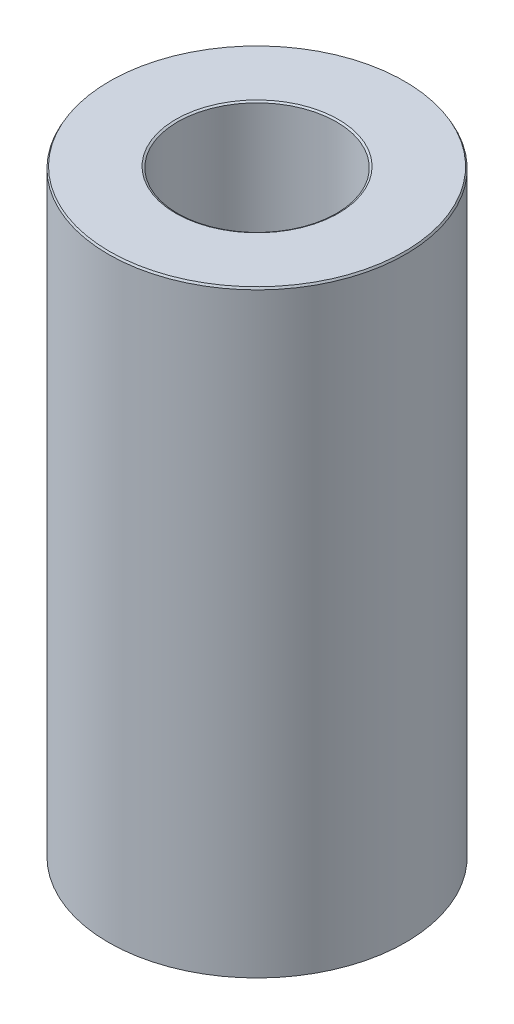
from build123d import *
from OCP.BRepFilletAPI import BRepFilletAPI_MakeChamfer

# Parameters (mm, degrees)
SKETCH1_R           = 25
BOSS_EXTRUDE1_DEPTH = 100.771122174
SKETCH2_R           = 13.361234096
CUT_EXTRUDE1_DEPTH  = 107.793347472
CHAMFER1_SIZE       = 0.326160533
CHAMFER1_SIZE2      = 0.188308871


with BuildPart() as part:
    # Sketch1 → Boss-Extrude1 (new body)
    with BuildSketch(Plane(origin=(0, 0, 0), x_dir=(1, 0, 0), z_dir=(0, 1, 0))):
        Circle(SKETCH1_R)
    extrude(amount=BOSS_EXTRUDE1_DEPTH)

    # Sketch2 → Cut-Extrude1 (cut, through all)
    with BuildSketch(Plane(origin=(0, 0, 0), x_dir=(1, 0, 0), z_dir=(0, 1, 0))):
        Circle(SKETCH2_R)
    extrude(amount=CUT_EXTRUDE1_DEPTH, mode=Mode.SUBTRACT)

    # Chamfer1: one chamfer whose edges measure the first distance from different faces: ONE call of the kernel's chamfer builder (chamfer() names one face for all edges)
    chamfer1_edges_1 = [part.edges().sort_by_distance(p)[0] for p in [
        (-13.361234096, 100.771122174, 0),
    ]]
    chamfer1_side_1 = [part.faces().sort_by_distance(p)[0] for p in [
        (-24.292893219, 100.771122174, 0),
    ]]
    chamfer1_edges_2 = [part.edges().sort_by_distance(p)[0] for p in [
        (-13.361234096, 0, 0),
    ]]
    chamfer1_side_2 = [part.faces().sort_by_distance(p)[0] for p in [
        (-13.361234096, 50.385561087, 0),
    ]]
    chamfer1_edges_3 = [part.edges().sort_by_distance(p)[0] for p in [
        (-25, 0, 0),
    ]]
    chamfer1_side_3 = [part.faces().sort_by_distance(p)[0] for p in [
        (-24.292893219, 0, 0),
    ]]
    chamfer1_edges_4 = [part.edges().sort_by_distance(p)[0] for p in [
        (-25, 100.771122174, 0),
    ]]
    chamfer1_side_4 = [part.faces().sort_by_distance(p)[0] for p in [
        (-25, 50.385561087, 0),
    ]]
    chamfer1 = BRepFilletAPI_MakeChamfer(part.part.solid().wrapped)
    for e in chamfer1_edges_1:
        chamfer1.Add(CHAMFER1_SIZE, CHAMFER1_SIZE2, e.wrapped, chamfer1_side_1[0].wrapped)  # the first distance lies on this face
    for e in chamfer1_edges_2:
        chamfer1.Add(CHAMFER1_SIZE, CHAMFER1_SIZE2, e.wrapped, chamfer1_side_2[0].wrapped)  # the first distance lies on this face
    for e in chamfer1_edges_3:
        chamfer1.Add(CHAMFER1_SIZE, CHAMFER1_SIZE2, e.wrapped, chamfer1_side_3[0].wrapped)  # the first distance lies on this face
    for e in chamfer1_edges_4:
        chamfer1.Add(CHAMFER1_SIZE, CHAMFER1_SIZE2, e.wrapped, chamfer1_side_4[0].wrapped)  # the first distance lies on this face
    add(Compound.cast(chamfer1.Shape()), mode=Mode.REPLACE)


solid = part.part
